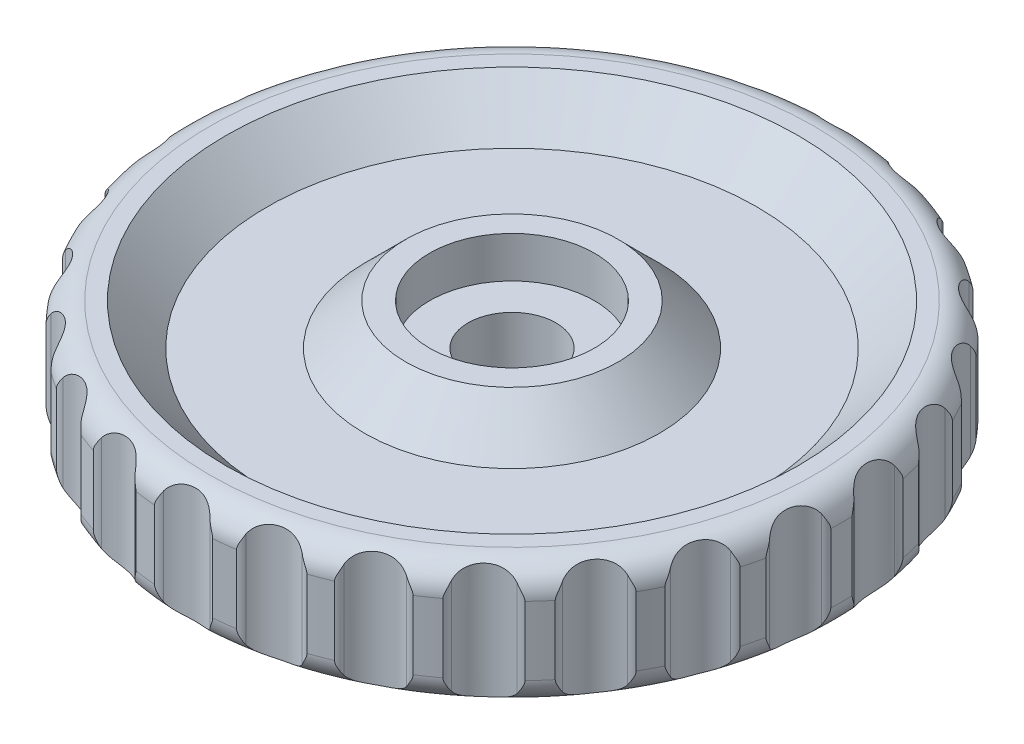
from build123d import *

# Parameters (mm, degrees)
SKETCH1_R           = 12
SKETCH1_R_2         = 1.6
BOSS_EXTRUDE1_DEPTH = 4.5
FILLET1_R           = 1
CUT_EXTRUDE2_DEPTH  = 18.557049866
SKETCH3_R           = 8.414195743
SKETCH3_R_2         = 5.868828688
SKETCH3_R_3         = 3
CUT_EXTRUDE3_DEPTH  = 1.5
CHAMFER1_SIZE       = 2
CUT_EXTRUDE4_DEPTH  = 1


with BuildPart() as part:
    # Sketch1 → Boss-Extrude1 (new body)
    with BuildSketch(Plane(origin=(0, 0, 0), x_dir=(1, 0, 0), z_dir=(0, 1, 0))):
        with Locations(Location((0, 0, 0), (0, 0, 270))):
            Circle(SKETCH1_R)
        with Locations(Location((0, 0, 0), (0, 0, 270))):
            Circle(SKETCH1_R_2, mode=Mode.SUBTRACT)
    extrude(amount=BOSS_EXTRUDE1_DEPTH)

    # Fillet1
    fillet1_edges = [part.edges().sort_by_distance(p)[0] for p in [
        (0, 0, -12),
        (0, 4.5, -12),
    ]]
    fillet(fillet1_edges, radius=FILLET1_R)

    # Sketch2 → Cut-Extrude2 (cut, through all)
    with BuildSketch(Plane(origin=(0, 4.5, 0), x_dir=(1, 0, 0), z_dir=(0, 1, 0))):
        with BuildLine():
            Line((-1.197317089, 11.952439633), (0, 13.275017528))
            Line((0, 13.275017528), (1.197317089, 11.952439633))
            ThreePointArc((1.197317089, 11.952439633), (1.007448129, 11.94007239), (0.847006857, 11.837789602))
            ThreePointArc((0.847006857, 11.837789602), (0, 11.5187946), (-0.847006857, 11.837789602))
            ThreePointArc((-0.847006857, 11.837789602), (-1.007448129, 11.94007239), (-1.197317089, 11.952439633))
        make_face()
        with BuildLine():
            Line((1.6978808, 11.891660194), (3.176919638, 12.889269645))
            Line((3.176919638, 12.889269645), (4.022931261, 11.318586725))
            ThreePointArc((4.022931261, 11.318586725), (3.835619873, 11.352017468), (3.655362859, 11.291102941))
            ThreePointArc((3.655362859, 11.291102941), (2.756627981, 11.184079363), (2.010574105, 11.696506959))
            ThreePointArc((2.010574105, 11.696506959), (1.879272838, 11.834213704), (1.6978808, 11.891660194))
        make_face()
        with BuildLine():
            Line((4.494404029, 11.139780689), (6.169208255, 11.754444261))
            Line((6.169208255, 11.754444261), (6.614747291, 10.026938698))
            ThreePointArc((6.614747291, 10.026938698), (6.440879332, 10.104224554), (6.251282459, 10.08821842))
            ThreePointArc((6.251282459, 10.08821842), (5.353050765, 10.199386087), (4.751307808, 10.875465846))
            ThreePointArc((4.751307808, 10.875465846), (4.656777299, 11.040593534), (4.494404029, 11.139780689))
        make_face()
        with BuildLine():
            Line((7.029728832, 9.740497623), (8.802964911, 9.936493302))
            Line((8.802964911, 9.936493302), (8.822138252, 8.152561441))
            ThreePointArc((8.822138252, 8.152561441), (8.671818295, 8.269210836), (8.483900244, 8.299043313))
            ThreePointArc((8.483900244, 8.299043313), (7.638373695, 8.621941564), (7.215912772, 9.42238219))
            ThreePointArc((7.215912772, 9.42238219), (7.16364679, 9.605334199), (7.029728832, 9.740497623))
        make_face()
        with BuildLine():
            Line((9.156511347, 7.775132239), (10.925125245, 7.54106947))
            Line((10.925125245, 7.54106947), (10.516818604, 5.804386946))
            ThreePointArc((10.516818604, 5.804386946), (10.398782701, 5.953620642), (10.223464586, 6.027557974))
            ThreePointArc((10.223464586, 6.027557974), (9.47978211, 6.543421137), (9.261155114, 7.421703929))
            ThreePointArc((9.261155114, 7.421703929), (9.254191168, 7.611847754), (9.156511347, 7.775132239))
        make_face()
        with BuildLine():
            Line((10.751150705, 5.357904431), (12.412357011, 4.707386091))
            Line((12.412357011, 4.707386091), (11.600299687, 3.11888258))
            ThreePointArc((11.600299687, 3.11888258), (11.521407653, 3.292027657), (11.368878326, 3.405772876))
            ThreePointArc((11.368878326, 3.405772876), (10.770260047, 4.084620858), (10.768172784, 4.989703213))
            ThreePointArc((10.768172784, 4.989703213), (10.806915593, 5.175988385), (10.751150705, 5.357904431))
        make_face()
        with BuildLine():
            Line((11.720972263, 2.629294693), (13.178227704, 1.600126543))
            Line((13.178227704, 1.600126543), (12.009613517, 0.252120095))
            ThreePointArc((12.009613517, 0.252120095), (11.974450271, 0.43911399), (11.853574182, 0.586056637))
            ThreePointArc((11.853574182, 0.586056637), (11.434809618, 1.388437262), (11.649383393, 2.267719083))
            ThreePointArc((11.649383393, 2.267719083), (11.731581365, 2.439319386), (11.720972263, 2.629294693))
        make_face()
        with BuildLine():
            Line((12.009613517, -0.252120095), (13.178227704, -1.600126543))
            Line((13.178227704, -1.600126543), (11.720972263, -2.629294693))
            ThreePointArc((11.720972263, -2.629294693), (11.731581365, -2.439319386), (11.649383393, -2.267719083))
            ThreePointArc((11.649383393, -2.267719083), (11.434809618, -1.388437262), (11.853574182, -0.586056637))
            ThreePointArc((11.853574182, -0.586056637), (11.974450271, -0.43911399), (12.009613517, -0.252120095))
        make_face()
        with BuildLine():
            Line((11.600299687, -3.11888258), (12.412357011, -4.707386091))
            Line((12.412357011, -4.707386091), (10.751150705, -5.357904431))
            ThreePointArc((10.751150705, -5.357904431), (10.806915593, -5.175988385), (10.768172784, -4.989703213))
            ThreePointArc((10.768172784, -4.989703213), (10.770260047, -4.084620858), (11.368878326, -3.405772876))
            ThreePointArc((11.368878326, -3.405772876), (11.521407653, -3.292027657), (11.600299687, -3.11888258))
        make_face()
        with BuildLine():
            Line((10.516818604, -5.804386946), (10.925125245, -7.54106947))
            Line((10.925125245, -7.54106947), (9.156511347, -7.775132239))
            ThreePointArc((9.156511347, -7.775132239), (9.254191168, -7.611847754), (9.261155114, -7.421703929))
            ThreePointArc((9.261155114, -7.421703929), (9.47978211, -6.543421137), (10.223464586, -6.027557974))
            ThreePointArc((10.223464586, -6.027557974), (10.398782701, -5.953620642), (10.516818604, -5.804386946))
        make_face()
        with BuildLine():
            Line((8.822138252, -8.152561441), (8.802964911, -9.936493302))
            Line((8.802964911, -9.936493302), (7.029728832, -9.740497623))
            ThreePointArc((7.029728832, -9.740497623), (7.16364679, -9.605334199), (7.215912772, -9.42238219))
            ThreePointArc((7.215912772, -9.42238219), (7.638373695, -8.621941564), (8.483900244, -8.299043313))
            ThreePointArc((8.483900244, -8.299043313), (8.671818295, -8.269210836), (8.822138252, -8.152561441))
        make_face()
        with BuildLine():
            Line((6.614747291, -10.026938698), (6.169208255, -11.754444261))
            Line((6.169208255, -11.754444261), (4.494404029, -11.139780689))
            ThreePointArc((4.494404029, -11.139780689), (4.656777299, -11.040593534), (4.751307808, -10.875465846))
            ThreePointArc((4.751307808, -10.875465846), (5.353050765, -10.199386087), (6.251282459, -10.08821842))
            ThreePointArc((6.251282459, -10.08821842), (6.440879332, -10.104224554), (6.614747291, -10.026938698))
        make_face()
        with BuildLine():
            Line((4.022931261, -11.318586725), (3.176919638, -12.889269645))
            Line((3.176919638, -12.889269645), (1.6978808, -11.891660194))
            ThreePointArc((1.6978808, -11.891660194), (1.879272838, -11.834213704), (2.010574105, -11.696506959))
            ThreePointArc((2.010574105, -11.696506959), (2.756627981, -11.184079363), (3.655362859, -11.291102941))
            ThreePointArc((3.655362859, -11.291102941), (3.835619873, -11.352017468), (4.022931261, -11.318586725))
        make_face()
        with BuildLine():
            Line((1.197317089, -11.952439633), (0, -13.275017528))
            Line((0, -13.275017528), (-1.197317089, -11.952439633))
            ThreePointArc((-1.197317089, -11.952439633), (-1.007448129, -11.94007239), (-0.847006857, -11.837789602))
            ThreePointArc((-0.847006857, -11.837789602), (0, -11.5187946), (0.847006857, -11.837789602))
            ThreePointArc((0.847006857, -11.837789602), (1.007448129, -11.94007239), (1.197317089, -11.952439633))
        make_face()
        with BuildLine():
            Line((-1.6978808, -11.891660194), (-3.176919638, -12.889269645))
            Line((-3.176919638, -12.889269645), (-4.022931261, -11.318586725))
            ThreePointArc((-4.022931261, -11.318586725), (-3.835619873, -11.352017468), (-3.655362859, -11.291102941))
            ThreePointArc((-3.655362859, -11.291102941), (-2.756627981, -11.184079363), (-2.010574105, -11.696506959))
            ThreePointArc((-2.010574105, -11.696506959), (-1.879272838, -11.834213704), (-1.6978808, -11.891660194))
        make_face()
        with BuildLine():
            Line((-4.494404029, -11.139780689), (-6.169208255, -11.754444261))
            Line((-6.169208255, -11.754444261), (-6.614747291, -10.026938698))
            ThreePointArc((-6.614747291, -10.026938698), (-6.440879332, -10.104224554), (-6.251282459, -10.08821842))
            ThreePointArc((-6.251282459, -10.08821842), (-5.353050765, -10.199386087), (-4.751307808, -10.875465846))
            ThreePointArc((-4.751307808, -10.875465846), (-4.656777299, -11.040593534), (-4.494404029, -11.139780689))
        make_face()
        with BuildLine():
            Line((-7.029728832, -9.740497623), (-8.802964911, -9.936493302))
            Line((-8.802964911, -9.936493302), (-8.822138252, -8.152561441))
            ThreePointArc((-8.822138252, -8.152561441), (-8.671818295, -8.269210836), (-8.483900244, -8.299043313))
            ThreePointArc((-8.483900244, -8.299043313), (-7.638373695, -8.621941564), (-7.215912772, -9.42238219))
            ThreePointArc((-7.215912772, -9.42238219), (-7.16364679, -9.605334199), (-7.029728832, -9.740497623))
        make_face()
        with BuildLine():
            Line((-9.156511347, -7.775132239), (-10.925125245, -7.54106947))
            Line((-10.925125245, -7.54106947), (-10.516818604, -5.804386946))
            ThreePointArc((-10.516818604, -5.804386946), (-10.398782701, -5.953620642), (-10.223464586, -6.027557974))
            ThreePointArc((-10.223464586, -6.027557974), (-9.47978211, -6.543421137), (-9.261155114, -7.421703929))
            ThreePointArc((-9.261155114, -7.421703929), (-9.254191168, -7.611847754), (-9.156511347, -7.775132239))
        make_face()
        with BuildLine():
            Line((-10.751150705, -5.357904431), (-12.412357011, -4.707386091))
            Line((-12.412357011, -4.707386091), (-11.600299687, -3.11888258))
            ThreePointArc((-11.600299687, -3.11888258), (-11.521407653, -3.292027657), (-11.368878326, -3.405772876))
            ThreePointArc((-11.368878326, -3.405772876), (-10.770260047, -4.084620858), (-10.768172784, -4.989703213))
            ThreePointArc((-10.768172784, -4.989703213), (-10.806915593, -5.175988385), (-10.751150705, -5.357904431))
        make_face()
        with BuildLine():
            Line((-11.720972263, -2.629294693), (-13.178227704, -1.600126543))
            Line((-13.178227704, -1.600126543), (-12.009613517, -0.252120095))
            ThreePointArc((-12.009613517, -0.252120095), (-11.974450271, -0.43911399), (-11.853574182, -0.586056637))
            ThreePointArc((-11.853574182, -0.586056637), (-11.434809618, -1.388437262), (-11.649383393, -2.267719083))
            ThreePointArc((-11.649383393, -2.267719083), (-11.731581365, -2.439319386), (-11.720972263, -2.629294693))
        make_face()
        with BuildLine():
            Line((-12.009613517, 0.252120095), (-13.178227704, 1.600126543))
            Line((-13.178227704, 1.600126543), (-11.720972263, 2.629294693))
            ThreePointArc((-11.720972263, 2.629294693), (-11.731581365, 2.439319386), (-11.649383393, 2.267719083))
            ThreePointArc((-11.649383393, 2.267719083), (-11.434809618, 1.388437262), (-11.853574182, 0.586056637))
            ThreePointArc((-11.853574182, 0.586056637), (-11.974450271, 0.43911399), (-12.009613517, 0.252120095))
        make_face()
        with BuildLine():
            Line((-11.600299687, 3.11888258), (-12.412357011, 4.707386091))
            Line((-12.412357011, 4.707386091), (-10.751150705, 5.357904431))
            ThreePointArc((-10.751150705, 5.357904431), (-10.806915593, 5.175988385), (-10.768172784, 4.989703213))
            ThreePointArc((-10.768172784, 4.989703213), (-10.770260047, 4.084620858), (-11.368878326, 3.405772876))
            ThreePointArc((-11.368878326, 3.405772876), (-11.521407653, 3.292027657), (-11.600299687, 3.11888258))
        make_face()
        with BuildLine():
            Line((-10.516818604, 5.804386946), (-10.925125245, 7.54106947))
            Line((-10.925125245, 7.54106947), (-9.156511347, 7.775132239))
            ThreePointArc((-9.156511347, 7.775132239), (-9.254191168, 7.611847754), (-9.261155114, 7.421703929))
            ThreePointArc((-9.261155114, 7.421703929), (-9.47978211, 6.543421137), (-10.223464586, 6.027557974))
            ThreePointArc((-10.223464586, 6.027557974), (-10.398782701, 5.953620642), (-10.516818604, 5.804386946))
        make_face()
        with BuildLine():
            Line((-8.822138252, 8.152561441), (-8.802964911, 9.936493302))
            Line((-8.802964911, 9.936493302), (-7.029728832, 9.740497623))
            ThreePointArc((-7.029728832, 9.740497623), (-7.16364679, 9.605334199), (-7.215912772, 9.42238219))
            ThreePointArc((-7.215912772, 9.42238219), (-7.638373695, 8.621941564), (-8.483900244, 8.299043313))
            ThreePointArc((-8.483900244, 8.299043313), (-8.671818295, 8.269210836), (-8.822138252, 8.152561441))
        make_face()
        with BuildLine():
            Line((-6.614747291, 10.026938698), (-6.169208255, 11.754444261))
            Line((-6.169208255, 11.754444261), (-4.494404029, 11.139780689))
            ThreePointArc((-4.494404029, 11.139780689), (-4.656777299, 11.040593534), (-4.751307808, 10.875465846))
            ThreePointArc((-4.751307808, 10.875465846), (-5.353050765, 10.199386087), (-6.251282459, 10.08821842))
            ThreePointArc((-6.251282459, 10.08821842), (-6.440879332, 10.104224554), (-6.614747291, 10.026938698))
        make_face()
        with BuildLine():
            Line((-4.022931261, 11.318586725), (-3.176919638, 12.889269645))
            Line((-3.176919638, 12.889269645), (-1.6978808, 11.891660194))
            ThreePointArc((-1.6978808, 11.891660194), (-1.879272838, 11.834213704), (-2.010574105, 11.696506959))
            ThreePointArc((-2.010574105, 11.696506959), (-2.756627981, 11.184079363), (-3.655362859, 11.291102941))
            ThreePointArc((-3.655362859, 11.291102941), (-3.835619873, 11.352017468), (-4.022931261, 11.318586725))
        make_face()
    extrude(amount=-CUT_EXTRUDE2_DEPTH, mode=Mode.SUBTRACT)

    # Sketch3 → Cut-Extrude3 (cut)
    # profile 1 of 2: a face of its own
    with BuildSketch(Plane(origin=(0, 4.5, 0), x_dir=(1, 0, 0), z_dir=(0, 1, 0))):
        with Locations(Location((0, 0, 0), (0, 0, 270))):
            Circle(SKETCH3_R)
        with Locations(Location((0, 0, 0), (0, 0, 270))):
            Circle(SKETCH3_R_2, mode=Mode.SUBTRACT)
    # profile 2 of 2: a face of its own
    with BuildSketch(Plane(origin=(0, 4.5, 0), x_dir=(1, 0, 0), z_dir=(0, 1, 0))):
        with Locations(Location((0, 0, 0), (0, 0, 270))):
            Circle(SKETCH3_R_3)
    extrude(amount=-CUT_EXTRUDE3_DEPTH, mode=Mode.SUBTRACT)

    # Chamfer1
    # the kernel refuses this chamfer: 2 mm, written as the material it takes off along each edge
    with BuildSketch(Plane(origin=(0, 4.5, 0), x_dir=(0, 0, 1), z_dir=(-1, 0, 0))) as chamfer1_piece_1_section:
        Polygon((8.414195743 + CHAMFER1_SIZE, 0), (8.414195743, -CHAMFER1_SIZE), (8.414195743, 0), align=None)
    chamfer1_piece_1 = revolve(axis=Axis((0, 4.5, 0), (0, 1, 0)), mode=Mode.PRIVATE)
    chamfer1_piece_1 = split(chamfer1_piece_1, bisect_by=Plane(origin=(0, 3, -9.657936377), z_dir=(0, 1, 0)), keep=Keep.TOP, mode=Mode.PRIVATE)
    add(chamfer1_piece_1, mode=Mode.SUBTRACT)
    with BuildSketch(Plane(origin=(0, 4.5, 0), x_dir=(0, 0, 1), z_dir=(-1, 0, 0))) as chamfer1_piece_2_section:
        Polygon((5.868828688, -CHAMFER1_SIZE), (5.868828688 - CHAMFER1_SIZE, 0), (5.868828688, 0), align=None)
    chamfer1_piece_2 = revolve(axis=Axis((0, 4.5, 0), (0, 1, 0)), mode=Mode.PRIVATE)
    chamfer1_piece_2 = split(chamfer1_piece_2, bisect_by=Plane(origin=(0, 3, -4.619126064), z_dir=(0, 1, 0)), keep=Keep.TOP, mode=Mode.PRIVATE)
    add(chamfer1_piece_2, mode=Mode.SUBTRACT)

    # Sketch4 → Cut-Extrude4 (cut)
    with BuildSketch(Plane.XZ):
        Polygon((2.628390914, -2.256448804), (3.268337443, 1.148028901), (0.639946529, 3.404477704), (-2.628390914, 2.256448804), (-3.268337443, -1.148028901), (-0.639946529, -3.404477704), align=None)
    extrude(amount=-CUT_EXTRUDE4_DEPTH, mode=Mode.SUBTRACT)


solid = part.part
